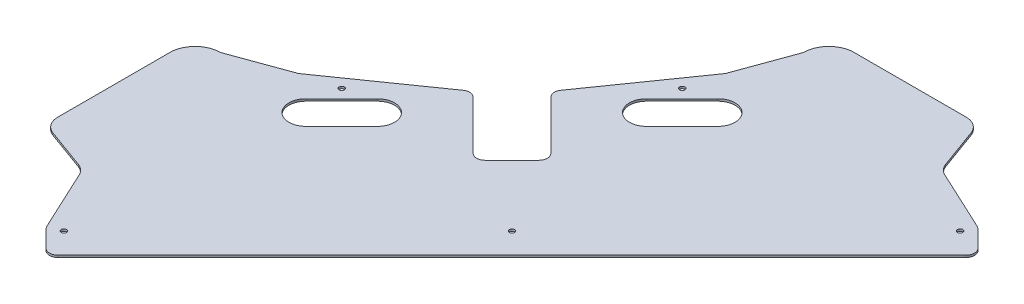
from build123d import *

# Parameters (mm, degrees)
BOSS_EXTRUDE1_DEPTH         = 3.175
FILLET3_R                   = 38.1
F_5_16_0_3125_DOWEL_HOLE1_D = 7.9375
F_1_2_DOWEL_SLOT1_DEPTH     = 3.175
FILLET4_R                   = 25.4
FILLET6_R                   = 12.7


# Read off the part's stored shape, not the designer's step: 1 (2) Dowel Slot1
with BuildPart() as part:
    # Sketch1 → Boss-Extrude1 (new body)
    with BuildSketch(Plane(origin=(0, 0, 0), x_dir=(1, 0, 0), z_dir=(0, 1, 0))):
        Polygon((246.957043329, -947.417020773), (947.417020773, -246.957043329), (911.495996289, -211.036018845), (808.524005584, -163.019391004), (776.924331502, -76.2), (552.45, -76.2), (552.45, -114.3), (521.073488184, -200.506257716), (413.091781569, -354.720116782), (502.89434278, -444.522677993), (444.522677993, -502.89434278), (354.720116782, -413.091781569), (200.506257716, -521.073488184), (114.3, -552.45), (76.2, -552.45), (76.2, -776.924331502), (163.019391004, -808.524005584), (211.036018845, -911.495996289), align=None)
    extrude(amount=BOSS_EXTRUDE1_DEPTH)

    # Fillet3
    fillet3_edges = [part.edges().sort_by_distance(p)[0] for p in [
        (76.2, 1.5875, 552.45),
        (552.45, 1.5875, 76.2),
    ]]
    fillet(fillet3_edges, radius=FILLET3_R - 0.0001)  # a hair under: the kernel refuses the full size

    # 5/16 (0.3125) Dowel Hole1 (through all)
    with Locations(Plane(origin=(0, 3.175, 0), x_dir=(1, 0, 0), z_dir=(0, 1, 0))):
        with Locations((252.197410095, -508.134709545), (508.134709545, -252.197410095), (902.515740167, -228.996531087), (228.996531087, -902.515740167), (565.756135627, -565.756135627)):
            Hole(F_5_16_0_3125_DOWEL_HOLE1_D / 2)

    # 1 (2) Dowel Slot1 outline → 1 (2) Dowel Slot1 (cut)
    with BuildSketch(Plane(origin=(0, 0, 0), x_dir=(1, 0, 0), z_dir=(0, 1, 0))):
        with BuildLine():
            Line((530.585349848, -328.529587124), (584.466886574, -274.648050397))
            ThreePointArc((584.466886574, -274.648050397), (584.466886574, -238.727025913), (548.54586209, -238.727025913))
            Line((548.54586209, -238.727025913), (494.664325364, -292.60856264))
            ThreePointArc((494.664325364, -292.60856264), (494.664325364, -328.529587124), (530.585349848, -328.529587124))
        make_face()
        with BuildLine():
            ThreePointArc((328.529587124, -530.585349848), (328.529587124, -494.664325364), (292.60856264, -494.664325364))
            Line((292.60856264, -494.664325364), (238.727025913, -548.54586209))
            ThreePointArc((238.727025913, -548.54586209), (238.727025913, -584.466886574), (274.648050397, -584.466886574))
            Line((274.648050397, -584.466886574), (328.529587124, -530.585349848))
        make_face()
    extrude(amount=F_1_2_DOWEL_SLOT1_DEPTH, mode=Mode.SUBTRACT)

    # Fillet4
    fillet4_edges = [part.edges().sort_by_distance(p)[0] for p in [
        (211.036018845, 1.5875, 911.495996289),
        (163.019391004, 1.5875, 808.524005584),
        (76.2, 1.5875, 776.924331502),
        (776.924331502, 1.5875, 76.2),
        (808.524005584, 1.5875, 163.019391004),
        (911.495996289, 1.5875, 211.036018845),
    ]]
    fillet(fillet4_edges, radius=FILLET4_R)

    # Fillet6
    fillet6_edges = [part.edges().sort_by_distance(p)[0] for p in [
        (947.417020773, 1.5875, 246.957043329),
        (246.957043329, 1.5875, 947.417020773),
        (114.3, 1.5875, 552.45),
        (200.506257716, 1.5875, 521.073488184),
        (354.720116782, 1.5875, 413.091781569),
        (444.522677993, 1.5875, 502.89434278),
        (502.89434278, 1.5875, 444.522677993),
        (413.091781569, 1.5875, 354.720116782),
        (521.073488184, 1.5875, 200.506257716),
        (552.45, 1.5875, 114.3),
    ]]
    fillet(fillet6_edges, radius=FILLET6_R)


solid = part.part
